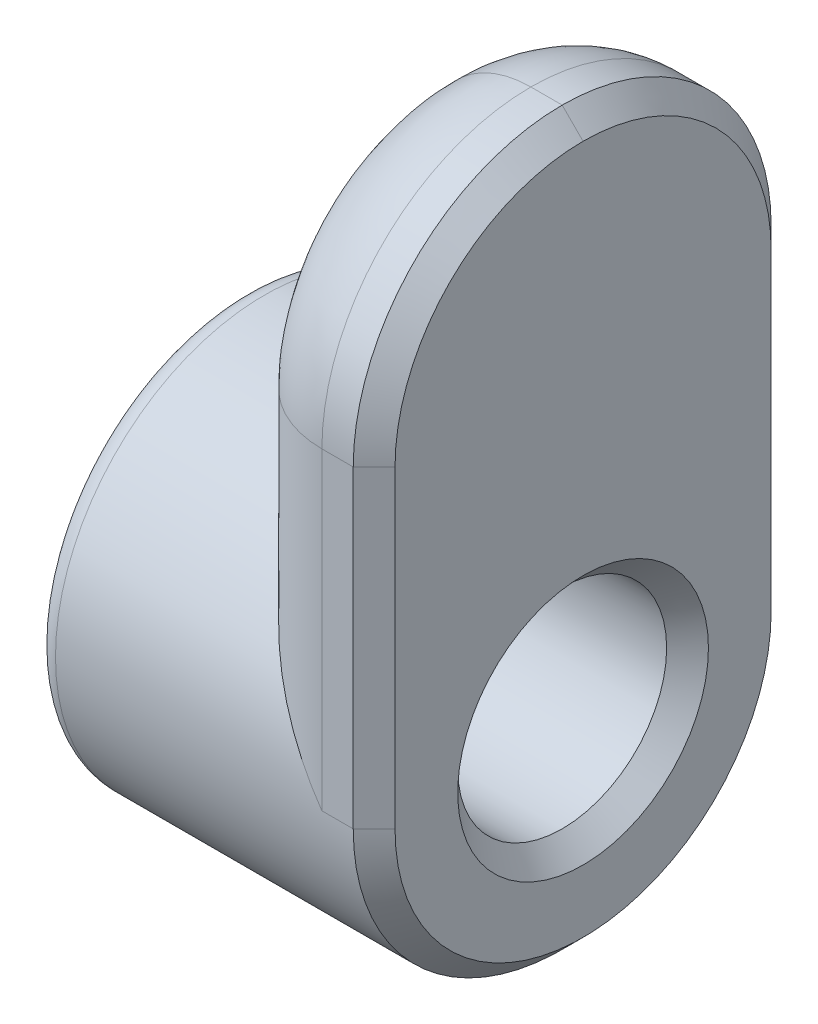
from build123d import *

# Parameters (mm, degrees)
SKETCH_1_R      = 4
SKETCH_1_R_2    = 2
EXTRUDE_1_DEPTH = 6.5
EXTRUDE_START   = -3
EXTRUDE_2_DEPTH = 3
FILLET_1_R      = 4
CHAMFER_1_SIZE  = 0.4
FILLET_2_R      = 2
FILLET_3_R      = 0.4


# Some blends are built 0.0001 mm under size
with BuildPart() as part:
    # 草图1 → 凸台-拉伸1 (new body)
    with BuildSketch(Plane(origin=(0, 0, 0), x_dir=(0, 0, -1), z_dir=(1, 0, 0))):
        with Locations(Location((0, 0, 0), (0, 0, 180))):
            Circle(SKETCH_1_R)
        with Locations(Location((0, 0, 0), (0, 0, 180))):
            Circle(SKETCH_1_R_2, mode=Mode.SUBTRACT)
    extrude(amount=EXTRUDE_1_DEPTH)

    # 草图2 → 凸台-拉伸2 (add)
    with BuildSketch(Plane(origin=(6.5, 0, 0), x_dir=(0, 0, -1), z_dir=(1, 0, 0)).offset(EXTRUDE_START)):
        with BuildLine():
            Line((2, 0), (4, 0))
            Line((4, 0), (4, 10))
            Line((4, 10), (-4, 10))
            Line((-4, 10), (-4, 0))
            Line((-4, 0), (-2, 0))
            ThreePointArc((-2, 0), (0, 2), (2, 0))
        make_face()
    extrude(amount=EXTRUDE_2_DEPTH)

    # 圆角1
    fillet_1_edges = [part.edges().sort_by_distance(p)[0] for p in [
        (5, 10, -4),
        (5, 10, 4),
    ]]
    fillet(fillet_1_edges, radius=FILLET_1_R - 0.0001)  # a hair under: the kernel refuses the full size

    # 倒角1
    chamfer_1_edges = [part.edges().sort_by_distance(p)[0] for p in [
        (6.5, -4, 0),
        (6.5, 3.00005, -4),
        (6.5, 3.00005, 4),
        (6.5, 8.828456414, 2.828456414),
        (6.5, 8.828456414, -2.828456414),
        (6.5, 0, -2),
    ]]
    chamfer(chamfer_1_edges, length=CHAMFER_1_SIZE)

    # 圆角2
    # the kernel refuses this fillet: 2 mm, written as the material it takes off along each edge
    with BuildSketch(Plane(origin=(3.5, -5, -4), x_dir=(0, 0, 1), z_dir=(0, 1, 0))) as fillet_2_piece_1_section:
        with BuildLine():
            CenterArc((FILLET_2_R, FILLET_2_R), FILLET_2_R, 180, 90)
            Line((0, FILLET_2_R), (0, 0))
            Line((0, 0), (FILLET_2_R, 0))
        make_face()
    fillet_2_piece_1 = extrude(amount=11.0001, mode=Mode.PRIVATE)
    fillet_2_piece_1 = fillet_2_piece_1 - Plane(origin=(4.073639318, 0, 0), x_dir=(0, 0, 1), z_dir=(-1, 0, 0)) * Cylinder(4, 31, mode=Mode.PRIVATE)
    add(fillet_2_piece_1, mode=Mode.SUBTRACT)
    with BuildSketch(Plane(origin=(3.5, 6.0001, 4), x_dir=(1, 0, 0), z_dir=(0, -1, 0))) as fillet_2_piece_2_section:
        with BuildLine():
            CenterArc((FILLET_2_R, -FILLET_2_R), FILLET_2_R, 90, 90)
            Line((0, -FILLET_2_R), (0, 0))
            Line((0, 0), (FILLET_2_R, 0))
        make_face()
    fillet_2_piece_2 = extrude(amount=11.0001, mode=Mode.PRIVATE)
    fillet_2_piece_2 = fillet_2_piece_2 - Plane(origin=(4.073638991, 0, 0), x_dir=(0, 0, 1), z_dir=(-1, 0, 0)) * Cylinder(4, 31, mode=Mode.PRIVATE)
    add(fillet_2_piece_2, mode=Mode.SUBTRACT)
    with BuildSketch(Plane(origin=(3.5, 6.0001, 0.0001), x_dir=(0, 0, 1), z_dir=(0, -1, 0))) as fillet_2_piece_3:
        with BuildLine():
            CenterArc((3.9999 - FILLET_2_R, -FILLET_2_R), FILLET_2_R, 0, 90)
            Line((3.9999 - FILLET_2_R, 0), (3.9999, 0))
            Line((3.9999, 0), (3.9999, -FILLET_2_R))
        make_face()
    revolve(axis=Axis((3.5, 6.0001, 0.0001), (-1, 0, 0)), revolution_arc=90, mode=Mode.SUBTRACT)
    with BuildSketch(Plane(origin=(3.5, 6.0001, -0.0001), x_dir=(0, 1, 0), z_dir=(0, 0, 1))) as fillet_2_piece_4:
        with BuildLine():
            CenterArc((3.9999 - FILLET_2_R, -FILLET_2_R), FILLET_2_R, 0, 90)
            Line((3.9999, -FILLET_2_R), (3.9999, 0))
            Line((3.9999, 0), (3.9999 - FILLET_2_R, 0))
        make_face()
    revolve(axis=Axis((3.5, 6.0001, -0.0001), (-1, 0, 0)), revolution_arc=90, mode=Mode.SUBTRACT)
    with BuildSketch(Plane(origin=(3.5, 10, -0.0001), x_dir=(0, -1, 0), z_dir=(0, 0, 1))) as fillet_2_piece_5:
        with BuildLine():
            CenterArc((FILLET_2_R, FILLET_2_R), FILLET_2_R, 180, 90)
            Line((0, FILLET_2_R), (0, 0))
            Line((0, 0), (FILLET_2_R, 0))
        make_face()
    extrude(amount=0.0002, mode=Mode.SUBTRACT)

    # 圆角3
    fillet_3_edges = [part.edges().sort_by_distance(p)[0] for p in [
        (0, 0, -4),
        (0, 0, -2),
    ]]
    fillet(fillet_3_edges, radius=FILLET_3_R)


solid = part.part
